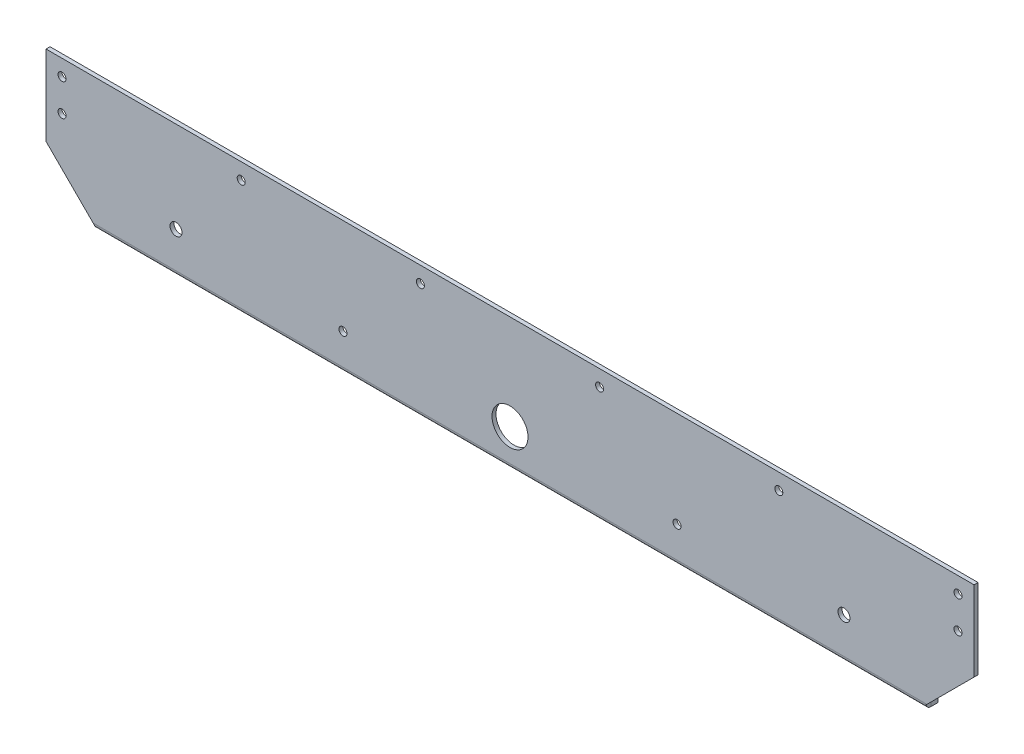
from build123d import *

# Parameters (mm, degrees)
SKETCH1_W                    = 736.6
SKETCH1_H                    = 101.6
BASE_FLANGE1_DEPTH           = 3.175
CUT_EXTRUDE2_DEPTH           = 3.175
EDGE_FLANGE1_STRIP_W         = 14.1732
EDGE_FLANGE1_STRIP_H         = 3.175
EDGE_FLANGE1_STRIP_CUT_DEPTH = 660.4
EDGE_FLANGE1_DEPTH           = 660.4
SKETCH12_R                   = 14.2875
SKETCH12_R_2                 = 4.7625
CUT_EXTRUDE3_DEPTH           = 373.35589998
SKETCH13_R                   = 3.175
CUT_EXTRUDE4_DEPTH           = 373.35589998


# Sheet-metal steps are written as plain solids
with BuildPart() as part:
    # Sketch1 → Base-Flange1 (new body)
    with BuildSketch(Plane.XY):
        Rectangle(SKETCH1_W, SKETCH1_H)
    extrude(amount=-BASE_FLANGE1_DEPTH)

    # Sketch11 → Cut-Extrude2 (cut)
    with BuildSketch(Plane.XY):
        Polygon((-368.3, -50.8), (-330.2, -50.8), (-368.3, -12.7), align=None)
        Polygon((368.3, -50.8), (330.2, -50.8), (368.3, -12.7), align=None)
    extrude(amount=-CUT_EXTRUDE2_DEPTH, mode=Mode.SUBTRACT)

    # Edge-Flange1 strip (across the edge) → Edge-Flange1 strip cut (cut)
    with BuildSketch(Plane(origin=(330.2, -50.8, -3.175), x_dir=(0, 1, 0), z_dir=(-1, 0, 0))):
        with Locations((-6.35, -1.5875)):
            Rectangle(EDGE_FLANGE1_STRIP_W, EDGE_FLANGE1_STRIP_H)
    extrude(amount=EDGE_FLANGE1_STRIP_CUT_DEPTH, mode=Mode.SUBTRACT)

    # Edge-Flange1 section (across the edge) → Edge-Flange1 (add)
    with BuildSketch(Plane(origin=(330.2, -50.8, -3.175), x_dir=(0, 1, 0), z_dir=(-1, 0, 0))):
        with BuildLine():
            Line((-3.175, 0.7366), (-3.175, 6.35))
            Line((-3.175, 6.35), (0, 6.35))
            Line((0, 6.35), (0, 0.7366))
            ThreePointArc((0, 0.7366), (0.215745145, 0.215745145), (0.7366, 0))
            Line((0.7366, 0), (0.7366, -3.175))
            ThreePointArc((0.7366, -3.175), (-2.029318885, -2.029318885), (-3.175, 0.7366))
        make_face()
    extrude(amount=EDGE_FLANGE1_DEPTH)

    # Sketch12 → Cut-Extrude3 (cut, through all)
    with BuildSketch(Plane.XY):
        with Locations((0, -24.6634)):
            Circle(SKETCH12_R)
        with Locations((-265.1125, -21.4884)):
            Circle(SKETCH12_R_2)
        with Locations((265.1125, -21.4884)):
            Circle(SKETCH12_R_2)
    extrude(amount=-CUT_EXTRUDE3_DEPTH, mode=Mode.SUBTRACT)

    # Sketch13 → Cut-Extrude4 (cut, through all)
    with BuildSketch(Plane.XY):
        with Locations((355.6, 38.1)):
            Circle(SKETCH13_R)
        with Locations((355.6, 12.7)):
            Circle(SKETCH13_R)
        with Locations((-355.6, 12.7)):
            Circle(SKETCH13_R)
        with Locations((-355.6, 38.1)):
            Circle(SKETCH13_R)
        with Locations((-213.36, 38.1)):
            Circle(SKETCH13_R)
        with Locations((-71.12, 38.1)):
            Circle(SKETCH13_R)
        with Locations((71.12, 38.1)):
            Circle(SKETCH13_R)
        with Locations((213.36, 38.1)):
            Circle(SKETCH13_R)
        with Locations((-132.584083533, -25.4)):
            Circle(SKETCH13_R)
        with Locations((132.584083533, -25.4)):
            Circle(SKETCH13_R)
    extrude(amount=-CUT_EXTRUDE4_DEPTH, mode=Mode.SUBTRACT)


solid = part.part
